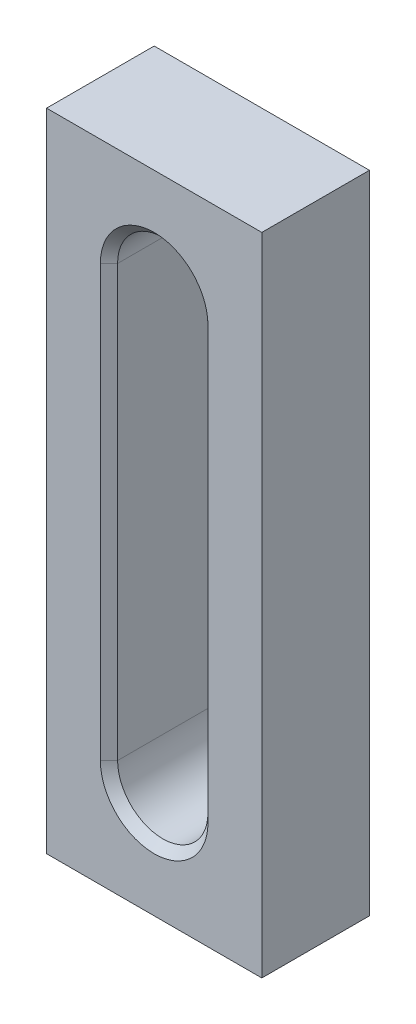
from build123d import *

# Parameters (mm, degrees)
SKETCH_1_W          = 50
SKETCH_1_H          = 150
EXTRUDE_1_DEPTH     = 25
CUT_EXTRUDE_1_DEPTH = 161.078105936
CHAMFER_1_SIZE      = 2


with BuildPart() as part:
    # Эскиз1 → Бобышка-Вытянуть1 (new body)
    with BuildSketch(Plane.XY):
        with Locations((25, 75)):
            Rectangle(SKETCH_1_W, SKETCH_1_H)
    extrude(amount=EXTRUDE_1_DEPTH)

    # Эскиз2 → Вырез-Вытянуть1 (cut, through all)
    with BuildSketch(Plane.XY.offset(25)):
        with BuildLine():
            Line((35.5, 125), (35.5, 25))
            ThreePointArc((35.5, 25), (25, 14.5), (14.5, 25))
            Line((14.5, 25), (14.5, 125))
            ThreePointArc((14.5, 125), (25, 135.5), (35.5, 125))
        make_face()
    extrude(amount=-CUT_EXTRUDE_1_DEPTH, mode=Mode.SUBTRACT)

    # Фаска1
    chamfer_1_edges = [part.edges().sort_by_distance(p)[0] for p in [
        (14.5, 75, 0),
        (25, 14.5, 0),
        (25, 135.5, 0),
        (35.5, 75, 0),
        (35.5, 75, 25),
        (25, 135.5, 25),
        (25, 14.5, 25),
        (14.5, 75, 25),
    ]]
    chamfer(chamfer_1_edges, length=CHAMFER_1_SIZE)


solid = part.part
